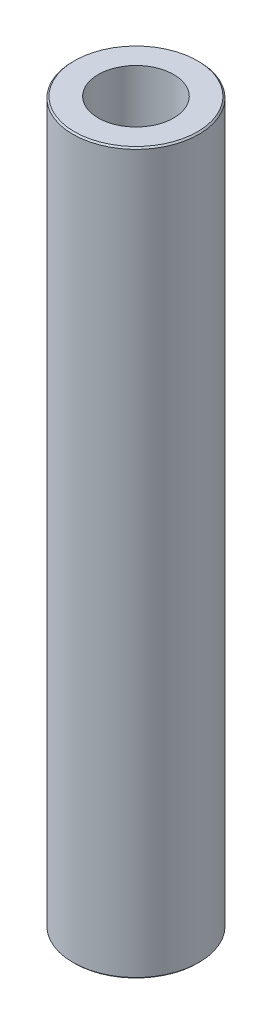
from build123d import *

# Parameters (mm, degrees)
SKETCH1_R           = 52.5
BOSS_EXTRUDE1_DEPTH = 600
SKETCH2_R           = 31.427089717
CUT_EXTRUDE1_DEPTH  = 605.576297914
CHAMFER1_SIZE       = 1.219056044


with BuildPart() as part:
    # Sketch1 → Boss-Extrude1 (new body)
    with BuildSketch(Plane(origin=(0, 0, 0), x_dir=(1, 0, 0), z_dir=(0, 1, 0))):
        Circle(SKETCH1_R)
    extrude(amount=BOSS_EXTRUDE1_DEPTH)

    # Sketch2 → Cut-Extrude1 (cut, through all)
    with BuildSketch(Plane(origin=(0, 0, 0), x_dir=(1, 0, 0), z_dir=(0, 1, 0))):
        Circle(SKETCH2_R)
    extrude(amount=CUT_EXTRUDE1_DEPTH, mode=Mode.SUBTRACT)

    # Chamfer1
    chamfer1_edges = [part.edges().sort_by_distance(p)[0] for p in [
        (-52.5, 600, 0),
        (-52.5, 0, 0),
    ]]
    chamfer(chamfer1_edges, length=CHAMFER1_SIZE)


solid = part.part
